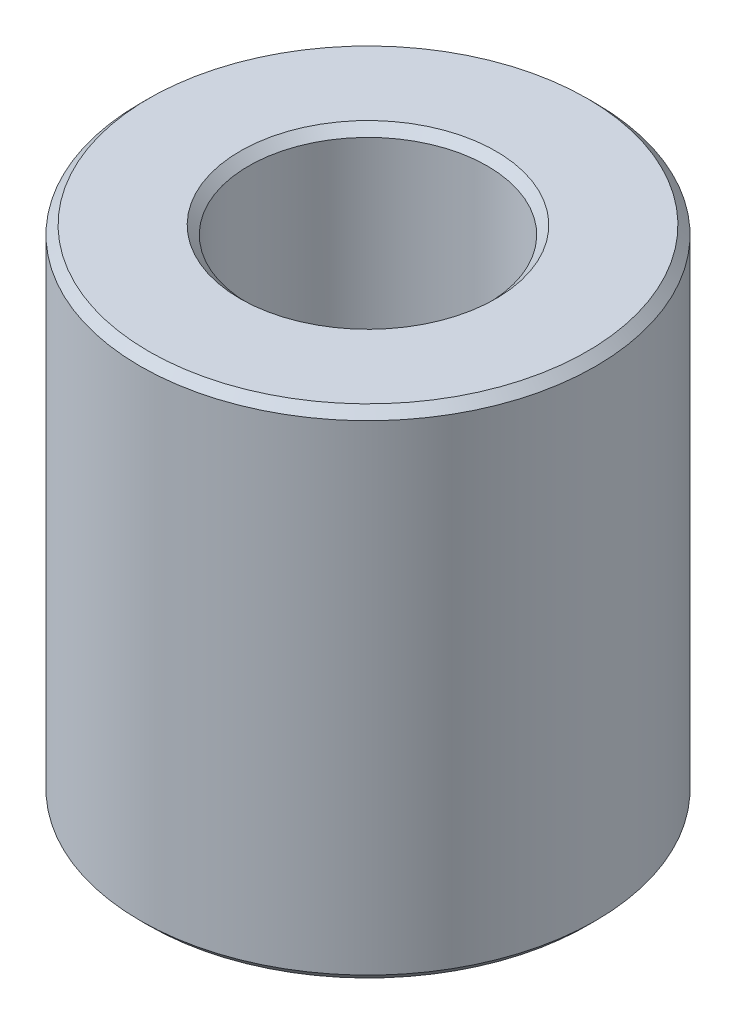
from build123d import *

# Parameters (mm, degrees)
SKETCH1_R           = 47.5
BOSS_EXTRUDE1_DEPTH = 103.715979349
SKETCH2_R           = 24.887568859
CUT_EXTRUDE1_DEPTH  = 124.569836013
CHAMFER1_SIZE       = 1.784828888


with BuildPart() as part:
    # Sketch1 → Boss-Extrude1 (new body)
    with BuildSketch(Plane(origin=(0, 0, 0), x_dir=(1, 0, 0), z_dir=(0, 1, 0))):
        Circle(SKETCH1_R)
    extrude(amount=BOSS_EXTRUDE1_DEPTH)

    # Sketch2 → Cut-Extrude1 (cut, through all)
    with BuildSketch(Plane(origin=(0, 0, 0), x_dir=(1, 0, 0), z_dir=(0, 1, 0))):
        Circle(SKETCH2_R)
    extrude(amount=CUT_EXTRUDE1_DEPTH, mode=Mode.SUBTRACT)

    # Chamfer1
    chamfer1_edges = [part.edges().sort_by_distance(p)[0] for p in [
        (-24.887568859, 103.715979349, 0),
        (-24.887568859, 0, 0),
        (-47.5, 0, 0),
        (-47.5, 103.715979349, 0),
    ]]
    chamfer(chamfer1_edges, length=CHAMFER1_SIZE)


solid = part.part
